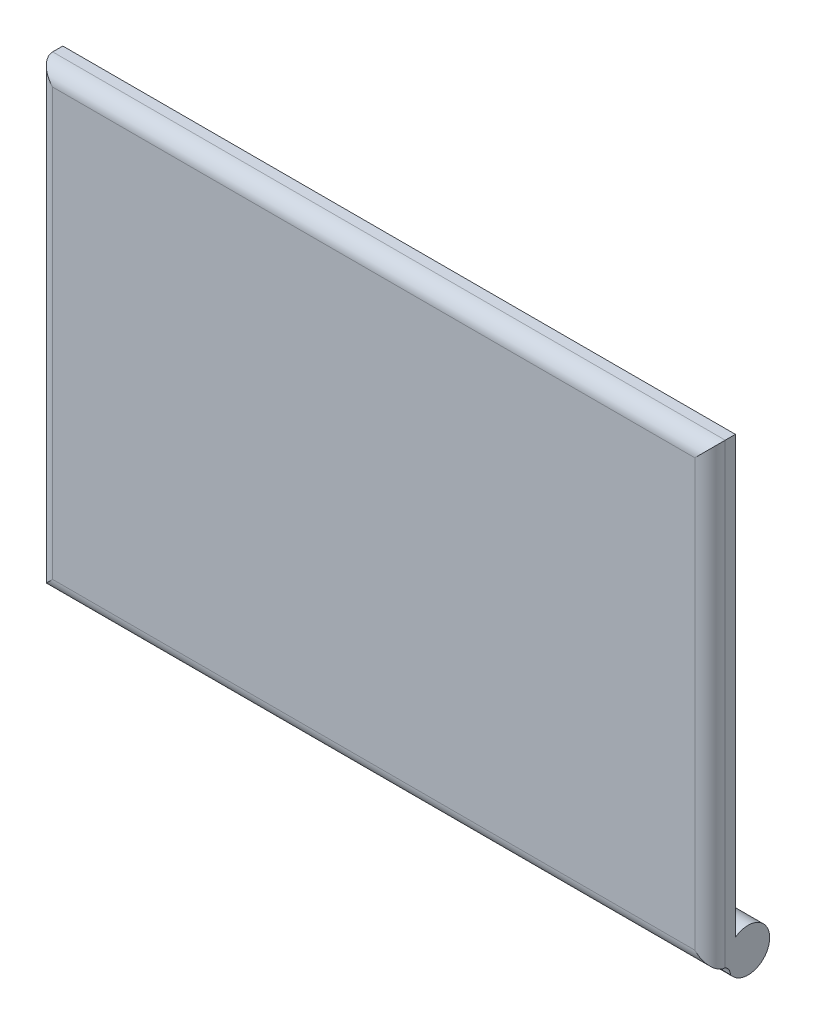
from build123d import *

# Parameters (mm, degrees)
SKETCH1_W           = 265
SKETCH1_H           = 180
BOSS_EXTRUDE1_DEPTH = 10
BOSS_EXTRUDE2_START = -17
BOSS_EXTRUDE2_DEPTH = 17
FILLET1_R           = 6
FILLET2_R           = 6
CUT_EXTRUDE2_START  = -265
CUT_EXTRUDE2_DEPTH  = 265


# Read off the part's stored shape, not the designer's step: Boss-Extrude2, Cut-Extrude2
with BuildPart() as part:
    # Sketch1 → Boss-Extrude1 (new body)
    with BuildSketch(Plane.XY):
        Rectangle(SKETCH1_W, SKETCH1_H)
    extrude(amount=BOSS_EXTRUDE1_DEPTH)

    # Boss-Extrude2 outline → Boss-Extrude2 (add)
    with BuildSketch(Plane.ZY.offset(132.5).offset(BOSS_EXTRUDE2_START)):
        with BuildLine():
            ThreePointArc((0, -81.626136458), (-13.387109794, -89.880720577), (1.939630355, -93.408312392))
            add(Edge.make_bspline(
                [(1.939630355, -93.408312392), (5.863215247, -91.451215581), (10, -90)],
                knots=[0, 0, 0, 1, 1, 1], degree=2))
            Line((10, -90), (0, -90))
            Line((0, -90), (0, -81.626136458))
        make_face()
    boss_extrude2 = extrude(amount=BOSS_EXTRUDE2_DEPTH)

    # Mirror1: Boss-Extrude2 across plane
    add(boss_extrude2.mirror(Plane(origin=(0, 0, 0), x_dir=(0, 0, 1), z_dir=(1, 0, 0))))

    # Fillet1
    fillet1_edges = [part.edges().sort_by_distance(p)[0] for p in [
        (132.5, 0, 10),
        (0, 90, 10),
        (-132.5, 0, 10),
    ]]
    fillet(fillet1_edges, radius=FILLET1_R)

    # Fillet2
    fillet2_edges = [part.edges().sort_by_distance(p)[0] for p in [
        (0, -90, 10),
    ]]
    fillet(fillet2_edges, radius=FILLET2_R)

    # Cut-Extrude2 outline → Cut-Extrude2 (cut)
    with BuildSketch(Plane.ZY.offset(132.5).offset(CUT_EXTRUDE2_START)):
        with BuildLine():
            add(Edge.make_bspline(
                [(1.939630355, -93.408312392), (2.161603751, -91.034387849), (4, -90)],
                knots=[0, 0, 0, 1, 1, 1], degree=2))
            add(Edge.make_bspline(
                [(1.939630355, -93.408312392), (5.863215247, -91.451215581), (10, -90)],
                knots=[0, 0, 0, 1, 1, 1], degree=2))
            Line((10, -90), (10, -84))
            ThreePointArc((10, -84), (8.242640687, -88.242640687), (4, -90))
        make_face()
    extrude(amount=CUT_EXTRUDE2_DEPTH, mode=Mode.SUBTRACT)


solid = part.part
